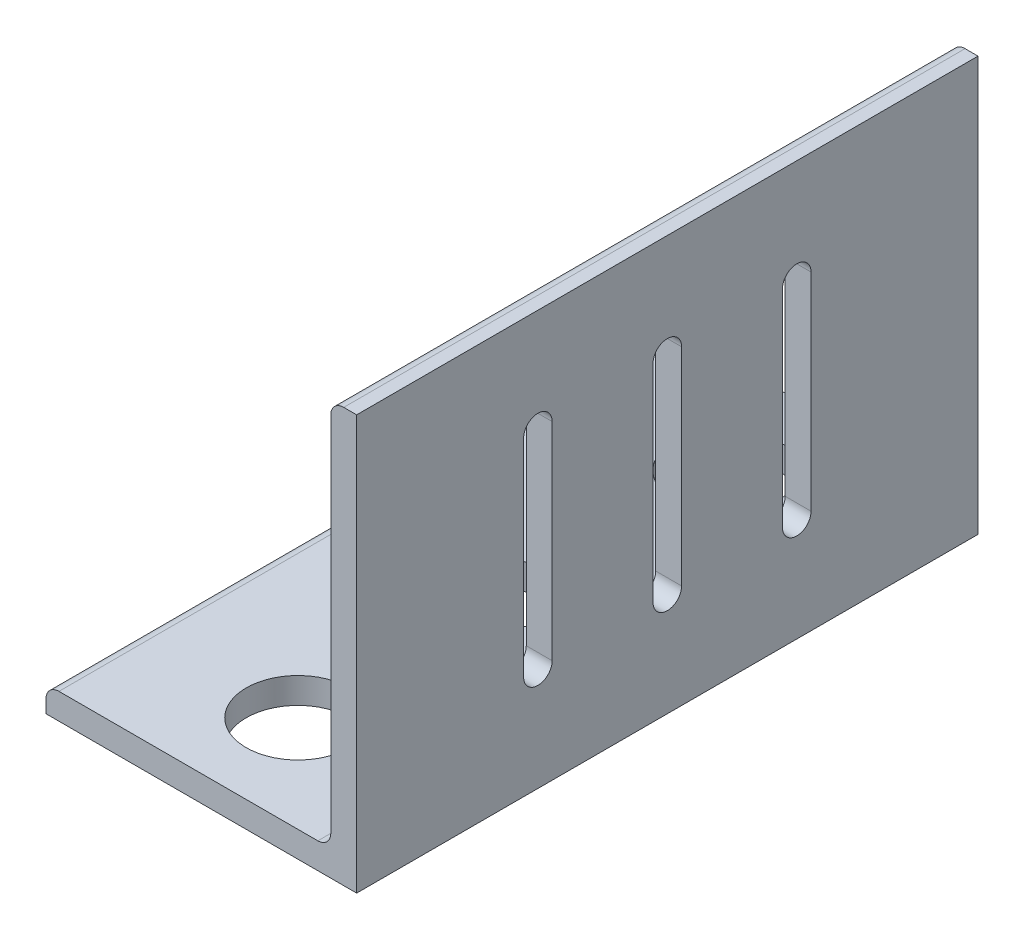
from build123d import *

# Parameters (mm, degrees)
BOSS_EXTRUDE1_DEPTH = 76.2
CUT_EXTRUDE1_DEPTH  = 10
SKETCH4_R           = 10
SKETCH4_R_2         = 12.7
CUT_EXTRUDE2_DEPTH  = 10


with BuildPart() as part:
    # Sketch2 → Boss-Extrude1 (new, symmetric)
    with BuildSketch(Plane.XY):
        with BuildLine():
            Line((-38.1, 0), (38.1, 0))
            Line((38.1, 0), (38.1, 101.6))
            Line((38.1, 101.6), (34.925, 101.6))
            ThreePointArc((34.925, 101.6), (32.67993597, 100.67006403), (31.75, 98.425))
            Line((31.75, 98.425), (31.75, 9.525))
            ThreePointArc((31.75, 9.525), (30.82006403, 7.27993597), (28.575, 6.35))
            Line((28.575, 6.35), (-34.925, 6.35))
            ThreePointArc((-34.925, 6.35), (-37.17006403, 5.42006403), (-38.1, 3.175))
            Line((-38.1, 3.175), (-38.1, 0))
        make_face()
    extrude(amount=BOSS_EXTRUDE1_DEPTH, both=True)

    # Sketch3 → Cut-Extrude1 (cut)
    with BuildSketch(Plane(origin=(38.1, 0, 0), x_dir=(0, 0, -1), z_dir=(1, 0, 0))):
        with BuildLine():
            Line((-28.25, 76.2), (-28.25, 25.4))
            ThreePointArc((-28.25, 25.4), (-31.75, 21.9), (-35.25, 25.4))
            Line((-35.25, 25.4), (-35.25, 76.2))
            ThreePointArc((-35.25, 76.2), (-31.75, 79.7), (-28.25, 76.2))
        make_face()
        with BuildLine():
            Line((28.25, 76.2), (28.25, 25.4))
            ThreePointArc((28.25, 25.4), (31.75, 21.9), (35.25, 25.4))
            Line((35.25, 25.4), (35.25, 76.2))
            ThreePointArc((35.25, 76.2), (31.75, 79.7), (28.25, 76.2))
        make_face()
        with BuildLine():
            Line((3.5, 76.2), (3.5, 25.4))
            ThreePointArc((3.5, 25.4), (0, 21.9), (-3.5, 25.4))
            Line((-3.5, 25.4), (-3.5, 76.2))
            ThreePointArc((-3.5, 76.2), (0, 79.7), (3.5, 76.2))
        make_face()
    extrude(amount=-CUT_EXTRUDE1_DEPTH, mode=Mode.SUBTRACT)

    # Sketch4 → Cut-Extrude2 (cut)
    with BuildSketch(Plane.XZ):
        Circle(SKETCH4_R)
        with Locations((0, 52.5)):
            Circle(SKETCH4_R_2)
        with Locations((0, -52.5)):
            Circle(SKETCH4_R_2)
    extrude(amount=-CUT_EXTRUDE2_DEPTH, mode=Mode.SUBTRACT)


solid = part.part
